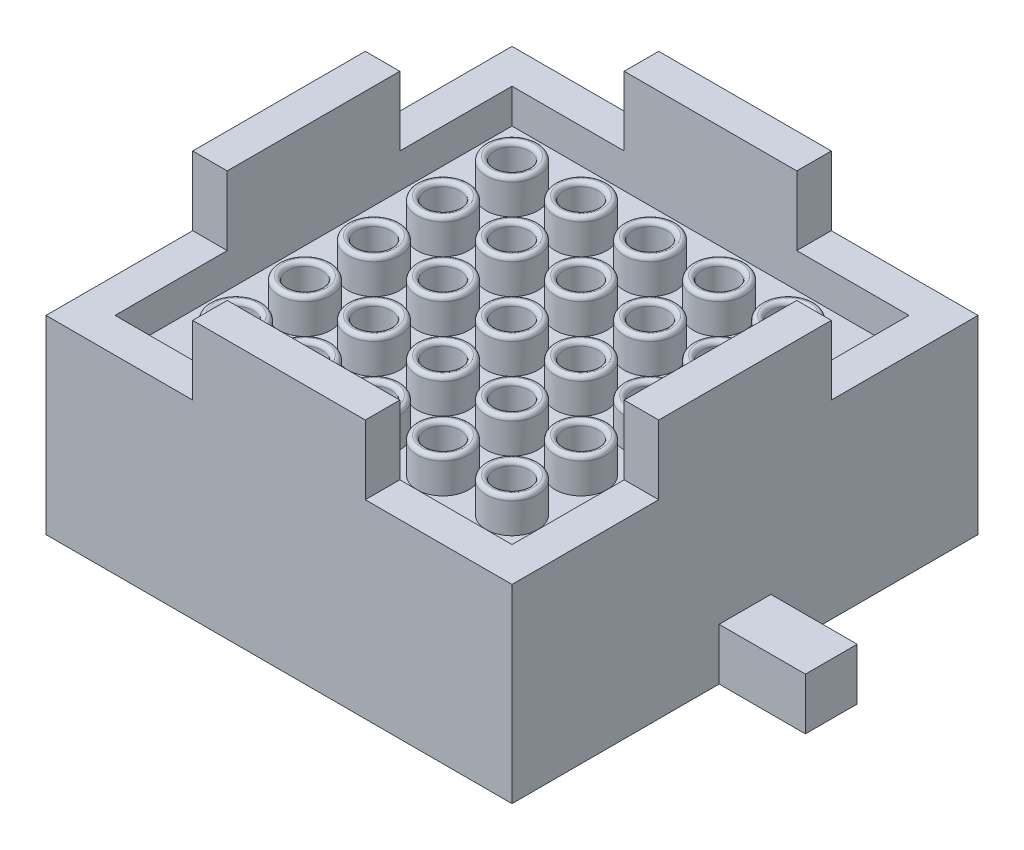
from build123d import *

# Parameters (mm, degrees)
SKETCH1_W              = 27
SKETCH1_H              = 27
SKETCH1_W_2            = 23
SKETCH1_H_2            = 23
BOSS_EXTRUDE1_DEPTH    = 2
SKETCH2_W              = 27
SKETCH2_H              = 27
BOSS_EXTRUDE2_DEPTH    = 2
SKETCH3_W              = 27
SKETCH3_H              = 27
SKETCH3_W_2            = 23
SKETCH3_H_2            = 23
BOSS_EXTRUDE3_DEPTH    = 5
SKETCH6_R              = 1.5
BOSS_EXTRUDE5_DEPTH    = 2
CUT_EXTRUDE2_REACH     = 23.107
SKETCH7_R              = 1
FILLET1_R              = 0.25
LPATTERN3_COUNT        = 5
LPATTERN3_PITCH        = 4
LPATTERN3_COUNT_DIR2   = 5
LPATTERN3_PITCH_DIR2   = 4
FILLET1_OF_LPATTERN3_R = 0.25
SKETCH11_R             = 0.75
BOSS_EXTRUDE8_DEPTH    = 5
LPATTERN2_COUNT        = 6
LPATTERN2_PITCH        = 4
LPATTERN2_COUNT_DIR2   = 6
LPATTERN2_PITCH_DIR2   = 4
SKETCH8_W              = 27
SKETCH8_H              = 27
BOSS_EXTRUDE6_DEPTH    = 2
SKETCH9_R              = 4.25
CUT_EXTRUDE3_DEPTH     = 7
SKETCH10_W             = 2
SKETCH10_H             = 10
BOSS_EXTRUDE7_DEPTH    = 4
CIRPATTERN2_COUNT      = 4
SKETCH12_W             = 3
SKETCH12_H             = 3
BOSS_EXTRUDE9_DEPTH    = 5
CIRPATTERN1_COUNT      = 2


with BuildPart() as part:
    # Sketch1 → Boss-Extrude1 (new body)
    with BuildSketch(Plane(origin=(0, 0, 0), x_dir=(1, 0, 0), z_dir=(0, 1, 0))):
        Rectangle(SKETCH1_W, SKETCH1_H)
        Rectangle(SKETCH1_W_2, SKETCH1_H_2, mode=Mode.SUBTRACT)
    extrude(amount=BOSS_EXTRUDE1_DEPTH)

    # Sketch2 → Boss-Extrude2 (add)
    with BuildSketch(Plane.XZ):
        Rectangle(SKETCH2_W, SKETCH2_H)
    extrude(amount=BOSS_EXTRUDE2_DEPTH)

    # Sketch3 → Boss-Extrude3 (add)
    with BuildSketch(Plane.XZ.offset(2)):
        Rectangle(SKETCH3_W, SKETCH3_H)
        Rectangle(SKETCH3_W_2, SKETCH3_H_2, mode=Mode.SUBTRACT)
    extrude(amount=BOSS_EXTRUDE3_DEPTH)

    # Sketch6 → Boss-Extrude5 (add)
    with BuildSketch(Plane(origin=(0, 0, 0), x_dir=(1, 0, 0), z_dir=(0, 1, 0))):
        with Locations(Location((8, 8, 0), (0, 0, 90))):
            Circle(SKETCH6_R)
    boss_extrude5 = extrude(amount=BOSS_EXTRUDE5_DEPTH)

    # Sketch7 → Cut-Extrude2 (cut, up to next)
    with BuildSketch(Plane(origin=(0, 2, 0), x_dir=(1, 0, 0), z_dir=(0, 1, 0)), mode=Mode.PRIVATE) as cut_extrude2_sk1:
        with Locations(Location((8, 8, 0), (0, 0, 270))):
            Circle(SKETCH7_R)
    cut_extrude2_tool1 = extrude(cut_extrude2_sk1.sketch, amount=-CUT_EXTRUDE2_REACH, mode=Mode.PRIVATE) & part.part
    cut_extrude2 = cut_extrude2_tool1.solids().sort_by_distance((8, 2, -8))[0]
    add(cut_extrude2, mode=Mode.SUBTRACT)

    # Fillet1
    fillet1_edges = [part.edges().sort_by_distance(p)[0] for p in [
        (8, 2, -6.5),
        (8, 2, -9),
    ]]
    fillet(fillet1_edges, radius=FILLET1_R - 0.0001)  # a hair under: the kernel refuses the full size

    # LPattern3: Boss-Extrude5, Cut-Extrude2 5 × 5
    with Locations(*[(-j * LPATTERN3_PITCH_DIR2, 0, i * LPATTERN3_PITCH) for i in range(LPATTERN3_COUNT) for j in range(LPATTERN3_COUNT_DIR2) if (i, j) != (0, 0)]):
        add(boss_extrude5)
        add(cut_extrude2, mode=Mode.SUBTRACT)

    # Fillet1 of LPattern3
    fillet1_of_lpattern3_edges = [part.edges().sort_by_distance(p)[0] for p in [
        (4, 2, -6.5),
        (4, 2, -9),
        (0, 2, -6.5),
        (0, 2, -9),
        (-4, 2, -6.5),
        (-4, 2, -9),
        (-8, 2, -6.5),
        (-8, 2, -9),
        (8, 2, -2.5),
        (8, 2, -5),
        (4, 2, -2.5),
        (4, 2, -5),
        (0, 2, -2.5),
        (0, 2, -5),
        (-4, 2, -2.5),
        (-4, 2, -5),
        (-8, 2, -2.5),
        (-8, 2, -5),
        (8, 2, 1.5),
        (8, 2, -1),
        (4, 2, 1.5),
        (4, 2, -1),
        (0, 2, 1.5),
        (0, 2, -1),
        (-4, 2, 1.5),
        (-4, 2, -1),
        (-8, 2, 1.5),
        (-8, 2, -1),
        (8, 2, 5.5),
        (8, 2, 3),
        (4, 2, 5.5),
        (4, 2, 3),
        (0, 2, 5.5),
        (0, 2, 3),
        (-4, 2, 5.5),
        (-4, 2, 3),
        (-8, 2, 5.5),
        (-8, 2, 3),
        (8, 2, 9.5),
        (8, 2, 7),
        (4, 2, 9.5),
        (4, 2, 7),
        (0, 2, 9.5),
        (0, 2, 7),
        (-4, 2, 9.5),
        (-4, 2, 7),
        (-8, 2, 9.5),
        (-8, 2, 7),
    ]]
    fillet(fillet1_of_lpattern3_edges, radius=FILLET1_OF_LPATTERN3_R - 0.0001)  # a hair under: the kernel refuses the full size

    # Sketch11 → Boss-Extrude8 (add)
    with BuildSketch(Plane.XZ.offset(2)):
        with Locations(Location((-9.9, 9.9, 0), (0, 0, 90))):
            Circle(SKETCH11_R)
    boss_extrude8 = extrude(amount=BOSS_EXTRUDE8_DEPTH)

    # LPattern2: Boss-Extrude8 6 × 6
    with Locations(*[(i * LPATTERN2_PITCH, 0, -j * LPATTERN2_PITCH_DIR2) for i in range(LPATTERN2_COUNT) for j in range(LPATTERN2_COUNT_DIR2) if (i, j) != (0, 0)]):
        add(boss_extrude8)

    # Sketch8 → Boss-Extrude6 (add)
    with BuildSketch(Plane.XZ.offset(7)):
        Rectangle(SKETCH8_W, SKETCH8_H)
    extrude(amount=BOSS_EXTRUDE6_DEPTH)

    # Sketch9 → Cut-Extrude3 (cut)
    with BuildSketch(Plane.XZ.offset(9)):
        with Locations(Location((0, 0, 0), (0, 0, 270))):
            Circle(SKETCH9_R)
    extrude(amount=-CUT_EXTRUDE3_DEPTH, mode=Mode.SUBTRACT)

    # Sketch10 → Boss-Extrude7 (add)
    with BuildSketch(Plane(origin=(0, 2, 0), x_dir=(1, 0, 0), z_dir=(0, 1, 0))):
        with Locations((-12.5, 0)):
            Rectangle(SKETCH10_W, SKETCH10_H)
    boss_extrude7 = extrude(amount=BOSS_EXTRUDE7_DEPTH)

    # CirPattern2: Boss-Extrude7 ×4 about axis
    cirpattern2_axis = Axis((0, 0, 0), (0, 1, 0))
    for i in range(1, CIRPATTERN2_COUNT):
        add(boss_extrude7.rotate(cirpattern2_axis, i * 360 / CIRPATTERN2_COUNT))

    # Sketch12 → Boss-Extrude9 (add)
    with BuildSketch(Plane.ZY.offset(13.5)):
        with Locations((0, -7.5)):
            Rectangle(SKETCH12_W, SKETCH12_H)
    boss_extrude9 = extrude(amount=BOSS_EXTRUDE9_DEPTH)

    # CirPattern1: Boss-Extrude9 ×2 about axis
    cirpattern1_axis = Axis((0, 0, 0), (0, 1, 0))
    for i in range(1, CIRPATTERN1_COUNT):
        add(boss_extrude9.rotate(cirpattern1_axis, i * 360 / CIRPATTERN1_COUNT))


solid = part.part
